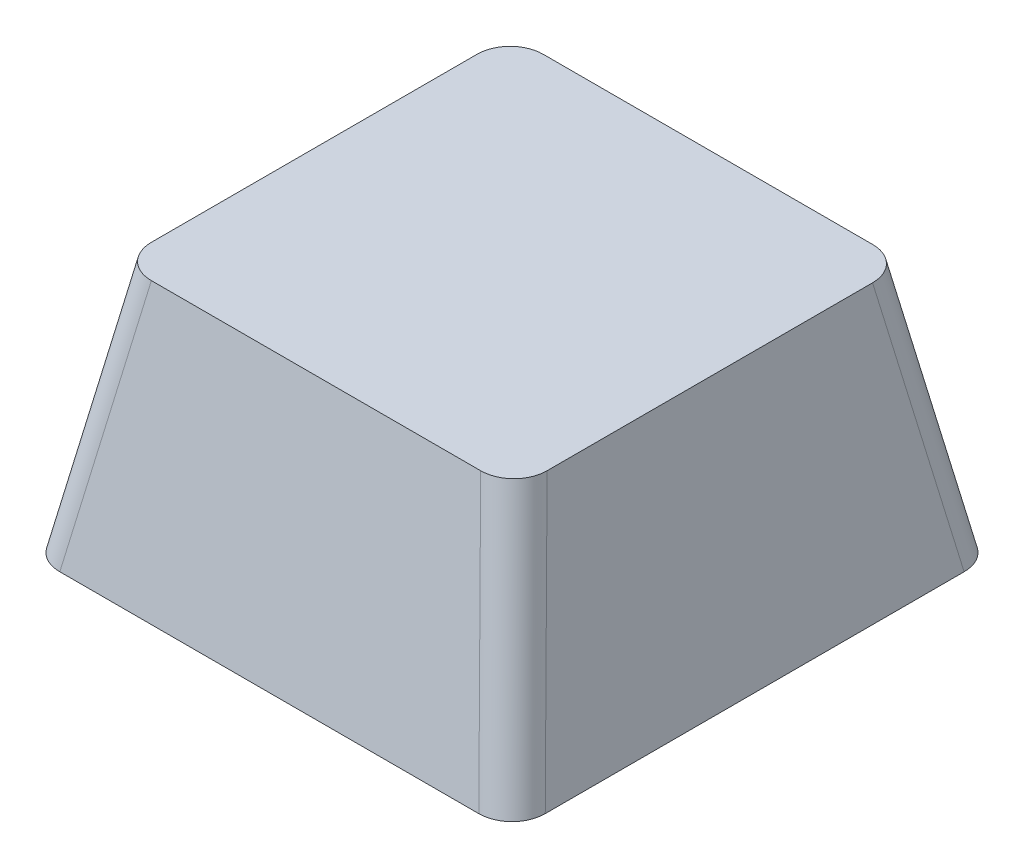
from build123d import *

# Parameters (mm, degrees)
FILLET1_R           = 1.25
BOSS_EXTRUDE1_REACH = 17.399
SKETCH8_R           = 2.8
SKETCH12_R          = 2.4
CUT_EXTRUDE8_DEPTH  = 6


with BuildPart() as part:
    # Sketch6 → Loft2 section 0
    with BuildSketch(Plane(origin=(0, 9.3, 0), x_dir=(1, 0, 0), z_dir=(0, 1, 0))):
        with BuildLine():
            Line((-7.324, 7.255), (7.324, 7.255))
            Line((7.324, 7.255), (7.324, -7.255))
            Line((7.324, -7.255), (-7.324, -7.255))
            Line((-7.324, -7.255), (-7.324, 7.255))
        make_face()
    # Sketch5 → Loft2 section 1
    with BuildSketch(Plane(origin=(0, 0, 0), x_dir=(1, 0, 0), z_dir=(0, 1, 0))):
        with BuildLine():
            Line((-8.9845, 8.9845), (8.9845, 8.9845))
            Line((8.9845, 8.9845), (8.9845, -8.9845))
            Line((8.9845, -8.9845), (-8.9845, -8.9845))
            Line((-8.9845, -8.9845), (-8.9845, 8.9845))
        make_face()
    loft()

    # Fillet1
    fillet1_edges = [part.edges().sort_by_distance(p)[0] for p in [
        (8.15425, 4.65, -8.11975),
        (8.15425, 4.65, 8.11975),
        (-8.15425, 4.65, -8.11975),
        (-8.15425, 4.65, 8.11975),
    ]]
    fillet(fillet1_edges, radius=FILLET1_R)

    # Shell1: read off the stored shape, not the designer's step
    # Shell1: loft between two sections, ruled curve by curve
    shell1_from = [
        Edge.make_line((-7.714731612, 0, -7.713068719), (7.714731612, 0, -7.713068719)),
        Edge.make_line((-7.714731612, 0, 7.713068719), (-7.714731612, 0, -7.713068719)),
        Edge.make_line((7.714731612, 0, 7.713068719), (7.714731612, 0, -7.713068719)),
        Edge.make_line((-7.714731612, 0, 7.713068719), (7.714731612, 0, 7.713068719)),
    ]
    shell1_to = [
        Edge.make_line((-6.277417095, 8.05, -6.216028397), (6.277417095, 8.05, -6.216028397)),
        Edge.make_line((-6.277417095, 8.05, 6.216028397), (-6.277417095, 8.05, -6.216028397)),
        Edge.make_line((6.277417095, 8.05, 6.216028397), (6.277417095, 8.05, -6.216028397)),
        Edge.make_line((-6.277417095, 8.05, 6.216028397), (6.277417095, 8.05, 6.216028397)),
    ]
    shell1 = Solid(Shell([*[Face.make_surface_from_curves(shell1_from[k], shell1_to[k]) for k in range(4)], Face(Wire(shell1_from)), Face(Wire(shell1_to))]))
    add(shell1, mode=Mode.SUBTRACT)

    # Sketch8 → Boss-Extrude1 (add, up to next)
    with BuildSketch(Plane(origin=(0, 0.6, 0), x_dir=(1, 0, 0), z_dir=(0, 1, 0)), mode=Mode.PRIVATE) as boss_extrude1_sk1:
        with Locations(Location((0, 0, 0), (0, 0, 270))):
            Circle(SKETCH8_R)
    boss_extrude1_tool1 = extrude(boss_extrude1_sk1.sketch, amount=BOSS_EXTRUDE1_REACH, mode=Mode.PRIVATE) - part.part
    add(boss_extrude1_tool1.solids().sort_by_distance((0, 0.6, 0))[0])

    # Sketch12 → Cut-Extrude8 (cut)
    with BuildSketch(Plane(origin=(0, 0.6, 0), x_dir=(1, 0, 0), z_dir=(0, 1, 0))):
        with Locations(Location((0, 0, 0), (0, 0, 270))):
            Circle(SKETCH12_R)
    extrude(amount=CUT_EXTRUDE8_DEPTH, mode=Mode.SUBTRACT)


solid = part.part
